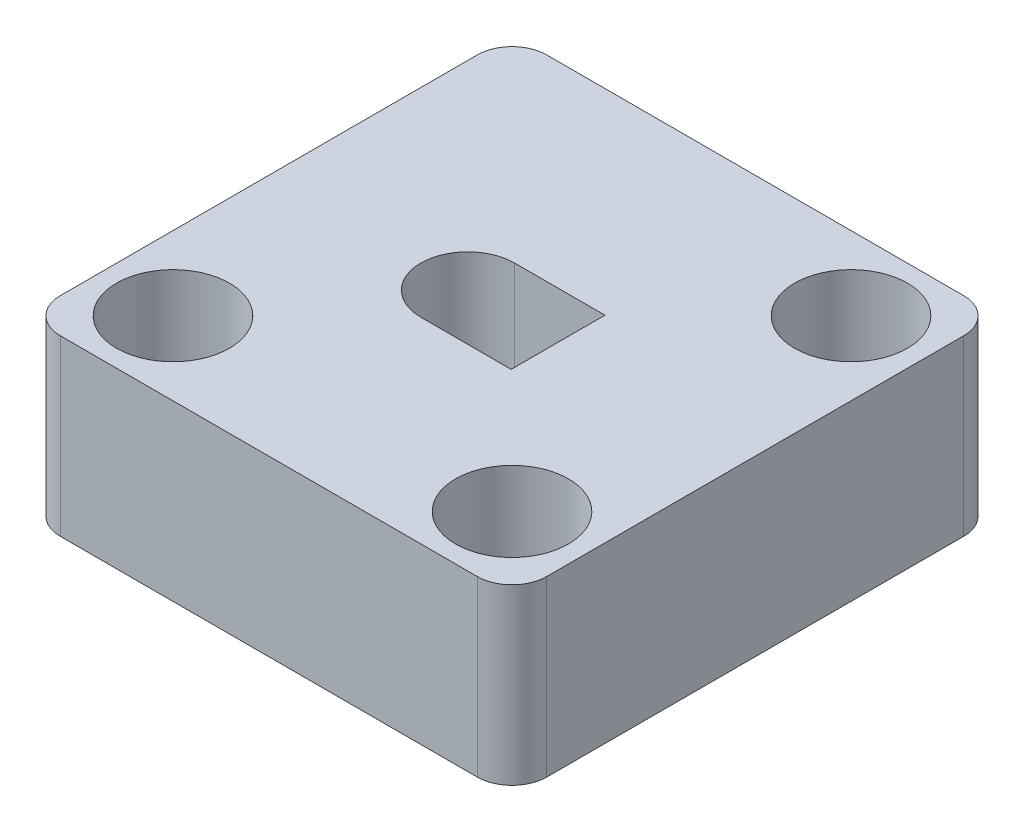
from build123d import *

# Parameters (mm, degrees)
SKETCH1_W           = 28
SKETCH1_H           = 28
SKETCH1_R           = 3.25
BOSS_EXTRUDE1_DEPTH = 10
FILLET1_R           = 2


with BuildPart() as part:
    # Sketch1 → Boss-Extrude1 (new body)
    with BuildSketch(Plane(origin=(0, 0, 0), x_dir=(1, 0, 0), z_dir=(0, 1, 0))):
        with Locations((14.93317339, 14.682508025)):
            Rectangle(SKETCH1_W, SKETCH1_H)
        with Locations((5.175814078, 4.925148712)):
            Circle(SKETCH1_R, mode=Mode.SUBTRACT)
        with Locations((24.690532703, 4.925148712)):
            Circle(SKETCH1_R, mode=Mode.SUBTRACT)
        with Locations((24.690532703, 24.439867338)):
            Circle(SKETCH1_R, mode=Mode.SUBTRACT)
        with BuildLine():
            Line((17.58317339, 17.382508025), (17.58317339, 11.982508025))
            Line((17.58317339, 11.982508025), (12.38317339, 11.982508025))
            ThreePointArc((12.38317339, 11.982508025), (9.68317339, 14.682508025), (12.38317339, 17.382508025))
            Line((12.38317339, 17.382508025), (17.58317339, 17.382508025))
        make_face(mode=Mode.SUBTRACT)
    extrude(amount=BOSS_EXTRUDE1_DEPTH)

    # Fillet1
    fillet1_edges = [part.edges().sort_by_distance(p)[0] for p in [
        (0.93317339, 5, -0.682508025),
        (0.93317339, 5, -28.682508025),
        (28.93317339, 5, -28.682508025),
        (28.93317339, 5, -0.682508025),
    ]]
    fillet(fillet1_edges, radius=FILLET1_R)


solid = part.part
